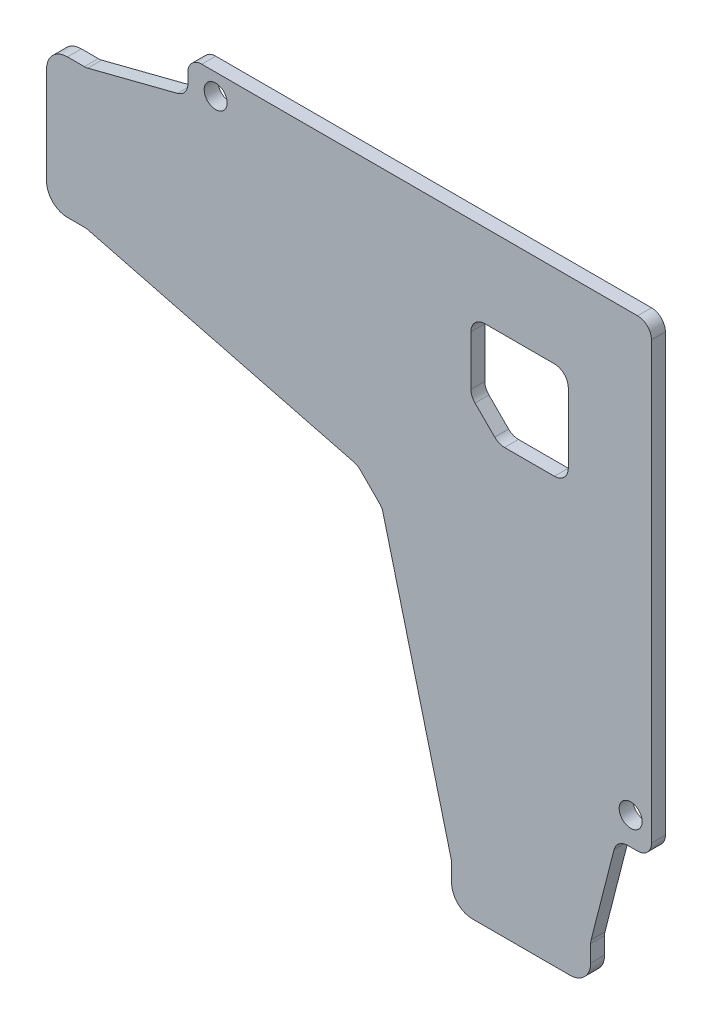
from build123d import *

# Parameters (mm, degrees)
BOSS_EXTRUDE1_DEPTH = 2
CUT_EXTRUDE2_DEPTH  = 122.638809596
BOSS_EXTRUDE2_DEPTH = 1.2
CHAMFER1_SIZE       = 1.2
SKETCH2_R           = 1.65
CUT_EXTRUDE3_DEPTH  = 122.638809596
FILLET1_R           = 3


with BuildPart() as part:
    # Sketch1 → Boss-Extrude1 (new body)
    with BuildSketch(Plane.XY):
        with BuildLine():
            Line((-86, -7.75), (-86, -27.75))
            Line((-86, -27.75), (-80.567396197, -27.75))
            ThreePointArc((-80.567396197, -27.75), (-80.317201092, -27.765711107), (-80.07093683, -27.81259759))
            Line((-80.07093683, -27.81259759), (-41.814217278, -37.615881976))
            ThreePointArc((-41.814217278, -37.615881976), (-41.320172025, -37.815786012), (-40.896463083, -38.139070823))
            Line((-40.896463083, -38.139070823), (-38.139070823, -40.896463083))
            ThreePointArc((-38.139070823, -40.896463083), (-37.815786012, -41.320172025), (-37.615881976, -41.814217278))
            Line((-37.615881976, -41.814217278), (-27.81259759, -80.07093683))
            ThreePointArc((-27.81259759, -80.07093683), (-27.765711107, -80.317201092), (-27.75, -80.567396197))
            Line((-27.75, -80.567396197), (-27.75, -86))
            Line((-27.75, -86), (-7.75, -86))
            Line((-7.75, -86), (-7.75, -80.567396197))
            ThreePointArc((-7.75, -80.567396197), (-7.734288893, -80.317201092), (-7.68740241, -80.07093683))
            Line((-7.68740241, -80.07093683), (-4.385282287, -67.184614401))
            ThreePointArc((-4.385282287, -67.184614401), (-3.674069354, -66.101054981), (-2.447879878, -65.681073768))
            Line((-2.447879878, -65.681073768), (-1, -65.681073768))
            ThreePointArc((-1, -65.681073768), (0.414213562, -65.09528733), (1, -63.681073768))
            Line((1, -63.681073768), (1, -1))
            ThreePointArc((1, -1), (0.414213562, 0.414213562), (-1, 1))
            Line((-1, 1), (-63.681073768, 1))
            ThreePointArc((-63.681073768, 1), (-65.09528733, 0.414213562), (-65.681073768, -1))
            Line((-65.681073768, -1), (-65.681073768, -2.447879878))
            ThreePointArc((-65.681073768, -2.447879878), (-66.101054981, -3.674069354), (-67.184614401, -4.385282287))
            Line((-67.184614401, -4.385282287), (-80.07093683, -7.68740241))
            ThreePointArc((-80.07093683, -7.68740241), (-80.317201092, -7.734288893), (-80.567396197, -7.75))
            Line((-80.567396197, -7.75), (-86, -7.75))
        make_face()
    extrude(amount=BOSS_EXTRUDE1_DEPTH)

    # Sketch4 → Cut-Extrude2 (cut, through all)
    with BuildSketch(Plane.XY):
        with BuildLine():
            Line((-24.968684618, -12.968684618), (-24.968684618, -20.140257493))
            ThreePointArc((-24.968684618, -20.140257493), (-24.816443683, -20.905624358), (-24.38289818, -21.554471055))
            Line((-24.38289818, -21.554471055), (-21.554471055, -24.38289818))
            ThreePointArc((-21.554471055, -24.38289818), (-20.905624358, -24.816443683), (-20.140257493, -24.968684618))
            Line((-20.140257493, -24.968684618), (-12.968684618, -24.968684618))
            ThreePointArc((-12.968684618, -24.968684618), (-11.554471055, -24.38289818), (-10.968684618, -22.968684618))
            Line((-10.968684618, -22.968684618), (-10.968684618, -12.968684618))
            ThreePointArc((-10.968684618, -12.968684618), (-11.554471055, -11.554471055), (-12.968684618, -10.968684618))
            Line((-12.968684618, -10.968684618), (-22.968684618, -10.968684618))
            ThreePointArc((-22.968684618, -10.968684618), (-24.38289818, -11.554471055), (-24.968684618, -12.968684618))
        make_face()
    extrude(amount=CUT_EXTRUDE2_DEPTH, mode=Mode.SUBTRACT)

    # Sketch5 → Boss-Extrude2 (add)
    with BuildSketch(Plane.XY):
        with BuildLine():
            Line((-78.471636399, -9.961587833), (-46.073118848, -1.659467711))
            ThreePointArc((-46.073118848, -1.659467711), (-45.839167799, -1.614925552), (-45.601482449, -1.6))
            Line((-45.601482449, -1.6), (-3.5, -1.6))
            ThreePointArc((-3.5, -1.6), (-2.156497116, -2.156497116), (-1.6, -3.5))
            Line((-1.6, -3.5), (-1.6, -45.601482449))
            ThreePointArc((-1.6, -45.601482449), (-1.614925552, -45.839167799), (-1.659467711, -46.073118848))
            Line((-1.659467711, -46.073118848), (-9.961587833, -78.471636399))
            ThreePointArc((-9.961587833, -78.471636399), (-10.63724012, -79.501017848), (-11.802120122, -79.9))
            Line((-11.802120122, -79.9), (-23.697879878, -79.9))
            ThreePointArc((-23.697879878, -79.9), (-24.86275988, -79.501017848), (-25.538412167, -78.471636399))
            Line((-25.538412167, -78.471636399), (-35.267187197, -40.505685062))
            ThreePointArc((-35.267187197, -40.505685062), (-35.477086435, -39.986937546), (-35.816535486, -39.542043158))
            Line((-35.816535486, -39.542043158), (-39.542043158, -35.816535486))
            ThreePointArc((-39.542043158, -35.816535486), (-39.986937546, -35.477086435), (-40.505685062, -35.267187197))
            Line((-40.505685062, -35.267187197), (-78.471636399, -25.538412167))
            ThreePointArc((-78.471636399, -25.538412167), (-79.501017848, -24.86275988), (-79.9, -23.697879877))
            Line((-79.9, -23.697879877), (-79.9, -11.802120122))
            ThreePointArc((-79.9, -11.802120122), (-79.501017848, -10.63724012), (-78.471636399, -9.961587833))
        make_face()
        with BuildLine():
            Line((-77.8, -11.957332135), (-77.8, -23.542667865))
            Line((-77.8, -23.542667865), (-39.984402726, -33.232914667))
            ThreePointArc((-39.984402726, -33.232914667), (-38.946907695, -33.652713143), (-38.057118917, -34.331611246))
            Line((-38.057118917, -34.331611246), (-34.331611246, -38.057118917))
            ThreePointArc((-34.331611246, -38.057118917), (-33.652713143, -38.946907695), (-33.232914667, -39.984402726))
            Line((-33.232914667, -39.984402726), (-23.542667865, -77.8))
            Line((-23.542667865, -77.8), (-11.957332135, -77.8))
            Line((-11.957332135, -77.8), (-3.7, -45.57626484))
            Line((-3.7, -45.57626484), (-3.7, -3.7))
            Line((-3.7, -3.7), (-45.57626484, -3.7))
            Line((-45.57626484, -3.7), (-77.8, -11.957332135))
        make_face(mode=Mode.SUBTRACT)
    extrude(amount=-BOSS_EXTRUDE2_DEPTH)

    # Chamfer1
    chamfer1_edges = [part.edges().sort_by_distance(p)[0] for p in [
        (-28.387791266, -58.892201363, 0),
        (-33.652713143, -38.946907695, 0),
        (-36.194365081, -36.194365081, 0),
        (-38.946907695, -33.652713143, 0),
        (-17.75, -77.8, 0),
        (-7.828666067, -61.68813242, 0),
        (-3.7, -24.63813242, 0),
        (-24.63813242, -3.7, 0),
        (-61.68813242, -7.828666067, 0),
        (-77.8, -17.75, 0),
        (-58.892201363, -28.387791266, 0),
    ]]
    chamfer(chamfer1_edges, length=CHAMFER1_SIZE - 0.0001)  # a hair under: the kernel refuses the full size

    # Sketch2 → Cut-Extrude3 (cut, through all)
    with BuildSketch(Plane.XY):
        with Locations((-61.681073768, -2)):
            Circle(SKETCH2_R)
        with Locations((-2, -61.681073768)):
            Circle(SKETCH2_R)
    extrude(amount=CUT_EXTRUDE3_DEPTH, mode=Mode.SUBTRACT)

    # Fillet1
    fillet1_edges = [part.edges().sort_by_distance(p)[0] for p in [
        (-7.75, -86, 1),
        (-27.75, -86, 1),
        (-86, -27.75, 1),
        (-86, -7.75, 1),
    ]]
    fillet(fillet1_edges, radius=FILLET1_R)


solid = part.part
